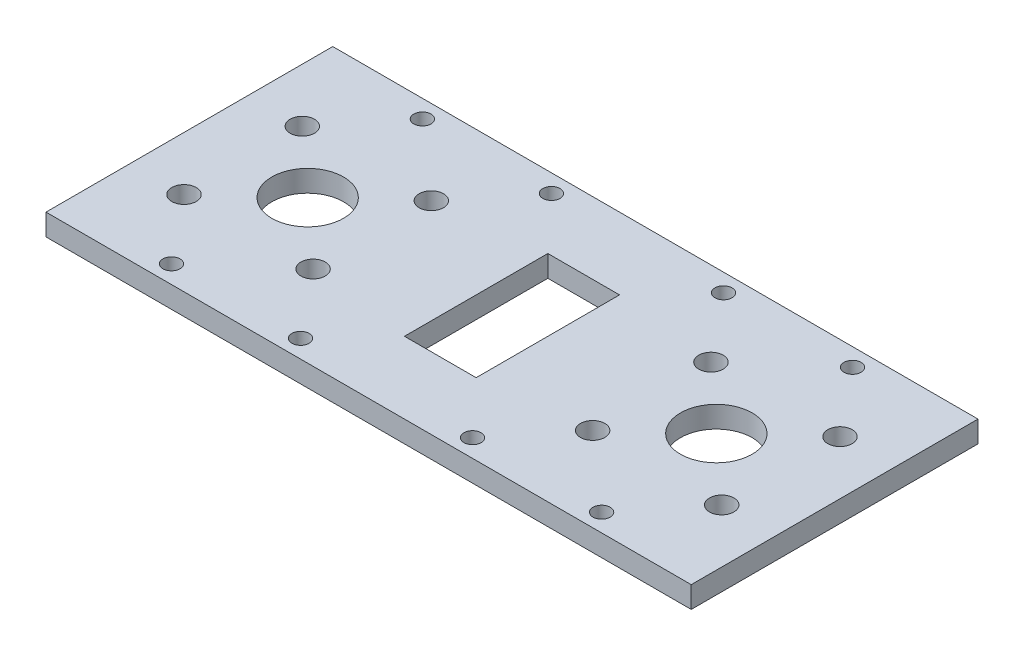
from build123d import *

# Parameters (mm, degrees)
SKETCH1_W           = 90
SKETCH1_H           = 40
SKETCH1_R           = 5
SKETCH1_R_2         = 1.7
SKETCH1_W_2         = 10
SKETCH1_H_2         = 20
BOSS_EXTRUDE1_DEPTH = 3
SKETCH3_R           = 1.2
CUT_EXTRUDE1_DEPTH  = 10


with BuildPart() as part:
    # Sketch1 → Boss-Extrude1 (new body)
    with BuildSketch(Plane(origin=(0, 0, 0), x_dir=(1, 0, 0), z_dir=(0, 1, 0))):
        Rectangle(SKETCH1_W, SKETCH1_H)
        with Locations((-28.5, 0)):
            Circle(SKETCH1_R, mode=Mode.SUBTRACT)
        with Locations((-37.5, 8.25)):
            Circle(SKETCH1_R_2, mode=Mode.SUBTRACT)
        with Locations((-19.5, 8.25)):
            Circle(SKETCH1_R_2, mode=Mode.SUBTRACT)
        with Locations((-19.5, -8.25)):
            Circle(SKETCH1_R_2, mode=Mode.SUBTRACT)
        with Locations((-37.5, -8.25)):
            Circle(SKETCH1_R_2, mode=Mode.SUBTRACT)
        with Locations((28.5, 0)):
            Circle(SKETCH1_R, mode=Mode.SUBTRACT)
        with Locations((19.5, 8.25)):
            Circle(SKETCH1_R_2, mode=Mode.SUBTRACT)
        with Locations((19.5, -8.25)):
            Circle(SKETCH1_R_2, mode=Mode.SUBTRACT)
        with Locations((37.5, -8.25)):
            Circle(SKETCH1_R_2, mode=Mode.SUBTRACT)
        with Locations((37.5, 8.25)):
            Circle(SKETCH1_R_2, mode=Mode.SUBTRACT)
        Rectangle(SKETCH1_W_2, SKETCH1_H_2, mode=Mode.SUBTRACT)
    extrude(amount=BOSS_EXTRUDE1_DEPTH)

    # Sketch3 → Cut-Extrude1 (cut)
    with BuildSketch(Plane(origin=(0, 3, 0), x_dir=(1, 0, 0), z_dir=(0, 1, 0))):
        with Locations((-12, 17.5)):
            Circle(SKETCH3_R)
        with Locations((-12, -17.5)):
            Circle(SKETCH3_R)
        with Locations((-30, 17.5)):
            Circle(SKETCH3_R)
        with Locations((-30, -17.5)):
            Circle(SKETCH3_R)
        with Locations((30, -17.5)):
            Circle(SKETCH3_R)
        with Locations((30, 17.5)):
            Circle(SKETCH3_R)
        with Locations((12, -17.5)):
            Circle(SKETCH3_R)
        with Locations((12, 17.5)):
            Circle(SKETCH3_R)
    extrude(amount=-CUT_EXTRUDE1_DEPTH, mode=Mode.SUBTRACT)


solid = part.part
